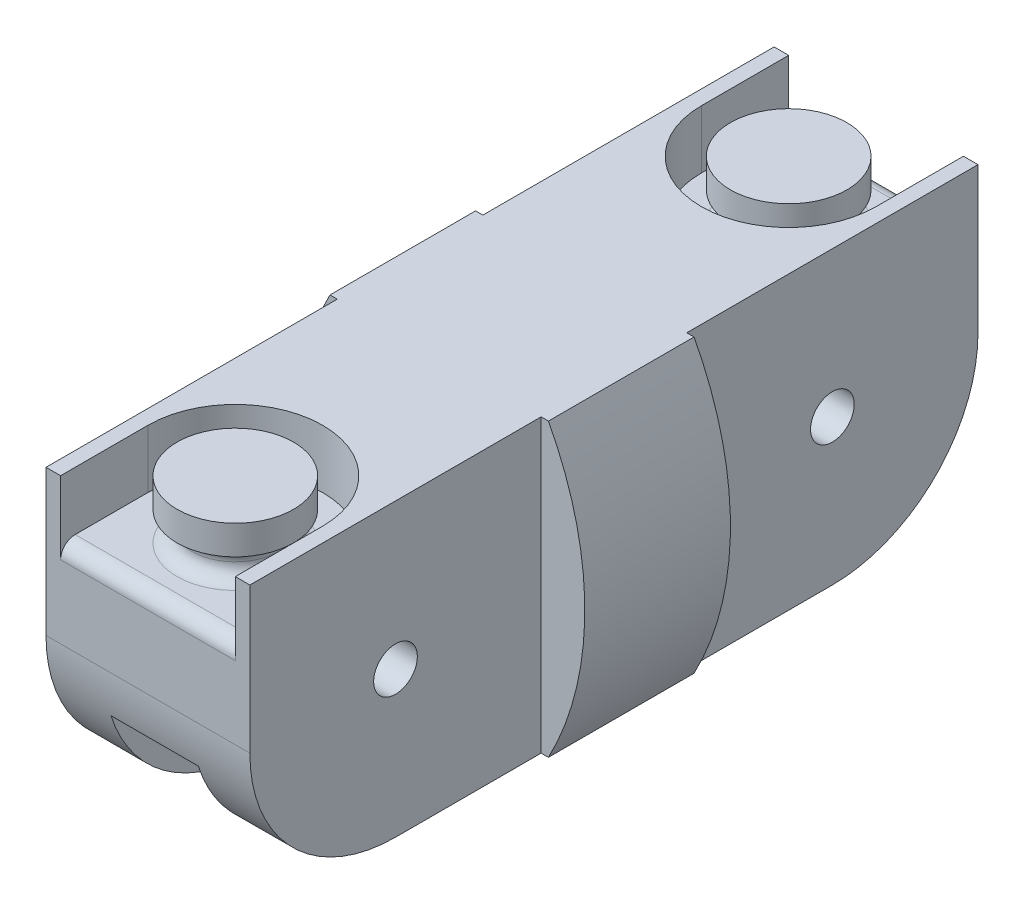
from build123d import *

# Parameters (mm, degrees)
SALIENTE_EXTRUIR1_DEPTH = 10
CROQUIS3_R              = 1.5
CORTAR_EXTRUIR1_DEPTH   = 10
SALIENTE_EXTRUIR2_DEPTH = 20
SALIENTE_EXTRUIR3_DEPTH = 20
CROQUIS6_R              = 1.5
CORTAR_EXTRUIR2_DEPTH   = 14
REDONDEO1_R             = 10
CUT_EXTRUDE1_DEPTH      = 4
SKETCH2_R               = 3
BOSS_EXTRUDE1_DEPTH     = 2
SKETCH3_R               = 4
BOSS_EXTRUDE2_DEPTH     = 2
FILLET1_R               = 1
FILLET2_R               = 1
FILLET3_R               = 1


with BuildPart() as part:
    # Croquis2 → Saliente-Extruir1 (new body)
    with BuildSketch(Plane.XY):
        with BuildLine():
            Line((-7.5, 10), (7.5, 10))
            ThreePointArc((7.5, 10), (10, 0), (7.5, -10))
            Line((7.5, -10), (-7.5, -10))
            ThreePointArc((-7.5, -10), (-10, 0), (-7.5, 10))
        make_face()
    extrude(amount=SALIENTE_EXTRUIR1_DEPTH)

    # Croquis3 → Cortar-Extruir1 (cut)
    with BuildSketch(Plane(origin=(0, 0, 0), x_dir=(-1, 0, 0), z_dir=(0, 0, -1))):
        with Locations((0, -7)):
            Circle(CROQUIS3_R)
    extrude(amount=-CORTAR_EXTRUIR1_DEPTH, mode=Mode.SUBTRACT)

    # Croquis4 → Saliente-Extruir2 (add)
    with BuildSketch(Plane(origin=(0, 0, 0), x_dir=(-1, 0, 0), z_dir=(0, 0, -1))):
        Polygon((-7, 10), (-7, -10), (-3, -10), (-3, -3), (3, -3), (3, -10), (7, -10), (7, 10), align=None)
    extrude(amount=SALIENTE_EXTRUIR2_DEPTH)

    # Croquis5 → Saliente-Extruir3 (add)
    with BuildSketch(Plane.XY.offset(10)):
        Polygon((-7, 10), (-7, -10), (-3, -10), (-3, -3), (3, -3), (3, -10), (7, -10), (7, 10), align=None)
    extrude(amount=SALIENTE_EXTRUIR3_DEPTH)

    # Croquis6 → Cortar-Extruir2 (cut)
    with BuildSketch(Plane(origin=(7, 0, 0), x_dir=(0, 0, -1), z_dir=(1, 0, 0))):
        with Locations((-20, 0)):
            Circle(CROQUIS6_R)
        with Locations((10, 0)):
            Circle(CROQUIS6_R)
    extrude(amount=-CORTAR_EXTRUIR2_DEPTH, mode=Mode.SUBTRACT)

    # Redondeo1
    redondeo1_edges = [part.edges().sort_by_distance(p)[0] for p in [
        (-5, -10, 30),
        (-5, -10, -20),
    ]]
    fillet(redondeo1_edges, radius=REDONDEO1_R)

    # Sketch1 → Cut-Extrude1 (cut)
    with BuildSketch(Plane(origin=(0, 10, 0), x_dir=(1, 0, 0), z_dir=(0, 1, 0))):
        with BuildLine():
            Line((-6, 14), (-6, 20))
            Line((-6, 20), (6, 20))
            Line((6, 20), (6, 14))
            ThreePointArc((6, 14), (0, 8), (-6, 14))
        make_face()
        with BuildLine():
            Line((-6, -24), (-6, -30))
            Line((-6, -30), (6, -30))
            Line((6, -30), (6, -24))
            ThreePointArc((6, -24), (0, -18), (-6, -24))
        make_face()
    extrude(amount=-CUT_EXTRUDE1_DEPTH, mode=Mode.SUBTRACT)

    # Sketch2 → Boss-Extrude1 (add)
    with BuildSketch(Plane(origin=(0, 6, 0), x_dir=(1, 0, 0), z_dir=(0, 1, 0))):
        with Locations(Location((0, 14, 0), (0, 0, 270))):
            Circle(SKETCH2_R)
        with Locations(Location((0, -24, 0), (0, 0, 270))):
            Circle(SKETCH2_R)
    extrude(amount=BOSS_EXTRUDE1_DEPTH)

    # Sketch3 → Boss-Extrude2 (add)
    with BuildSketch(Plane(origin=(0, 8, 0), x_dir=(1, 0, 0), z_dir=(0, 1, 0))):
        with Locations(Location((0, -24, 0), (0, 0, 270))):
            Circle(SKETCH3_R)
        with Locations(Location((0, 14, 0), (0, 0, 270))):
            Circle(SKETCH3_R)
    extrude(amount=BOSS_EXTRUDE2_DEPTH)

    # Fillet1
    fillet1_edges = [part.edges().sort_by_distance(p)[0] for p in [
        (0, 6, -17),
        (0, 8, -17),
        (0, 6, 21),
        (0, 8, 21),
    ]]
    fillet(fillet1_edges, radius=FILLET1_R - 0.0001)  # a hair under: the kernel refuses the full size

    # Fillet2
    fillet2_edges = [part.edges().sort_by_distance(p)[0] for p in [
        (0, 6, -20),
        (0, 6, 30),
    ]]
    fillet(fillet2_edges, radius=FILLET2_R)

    # Fillet3
    fillet3_edges = [part.edges().sort_by_distance(p)[0] for p in [
        (1.5, -7, 10),
        (1.5, -7, 0),
    ]]
    fillet(fillet3_edges, radius=FILLET3_R)


solid = part.part
